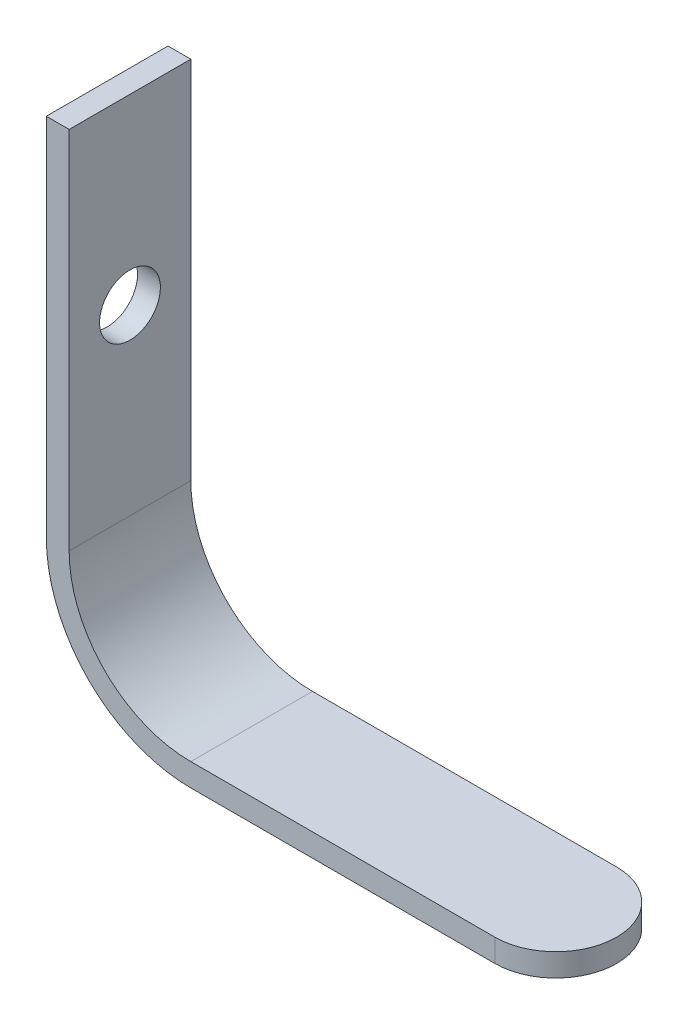
from build123d import *

# Parameters (mm, degrees)
EXTRUDE_THIN1_DEPTH      = 12.7
EXTRUDE_THIN1_DEPTH_BACK = 12.7
CUT_EXTRUDE1_DEPTH       = 4.7625
CUT_EXTRUDE2_REACH       = 146.244
SKETCH3_R                = 6.35


with BuildPart() as part:
    # Sketch1 → Extrude-Thin1 (new, two sides: drawn at the far end of the back side and taken through both)
    with BuildSketch(Plane.XY.offset(-EXTRUDE_THIN1_DEPTH_BACK)):
        with BuildLine():
            Line((0, 101.6), (0, 25.4))
            ThreePointArc((0, 25.4), (7.439487758, 7.439487758), (25.4, 0))
            Line((25.4, 0), (101.6, 0))
            Line((101.6, 0), (101.6, -4.7625))
            Line((101.6, -4.7625), (25.4, -4.7625))
            ThreePointArc((25.4, -4.7625), (4.071891712, 4.071891712), (-4.7625, 25.4))
            Line((-4.7625, 25.4), (-4.7625, 101.6))
            Line((-4.7625, 101.6), (0, 101.6))
        make_face()
    extrude(amount=EXTRUDE_THIN1_DEPTH + EXTRUDE_THIN1_DEPTH_BACK)

    # Sketch2 → Cut-Extrude1 (cut)
    with BuildSketch(Plane(origin=(0, 0, 0), x_dir=(-1, 0, 0), z_dir=(0, 1, 0))):
        with BuildLine():
            Line((-88.9, 12.7), (-88.9, 23.152683053))
            Line((-88.9, 23.152683053), (-107.491491885, 23.152683053))
            Line((-107.491491885, 23.152683053), (-107.491491885, -20.225178662))
            Line((-107.491491885, -20.225178662), (-88.9, -20.225178662))
            Line((-88.9, -20.225178662), (-88.9, -12.7))
            ThreePointArc((-88.9, -12.7), (-101.6, 0), (-88.9, 12.7))
        make_face()
    extrude(amount=-CUT_EXTRUDE1_DEPTH, mode=Mode.SUBTRACT)

    # Sketch3 → Cut-Extrude2 (cut, up to next)
    with BuildSketch(Plane(origin=(0, 0, 0), x_dir=(0, 0, -1), z_dir=(1, 0, 0)), mode=Mode.PRIVATE) as cut_extrude2_sk1:
        with Locations(Location((0, 63.5, 0), (0, 0, 90))):
            Circle(SKETCH3_R)
    cut_extrude2_tool1 = extrude(cut_extrude2_sk1.sketch, amount=-CUT_EXTRUDE2_REACH, mode=Mode.PRIVATE) & part.part
    add(cut_extrude2_tool1.solids().sort_by_distance((0, 63.5, 0))[0], mode=Mode.SUBTRACT)


solid = part.part
